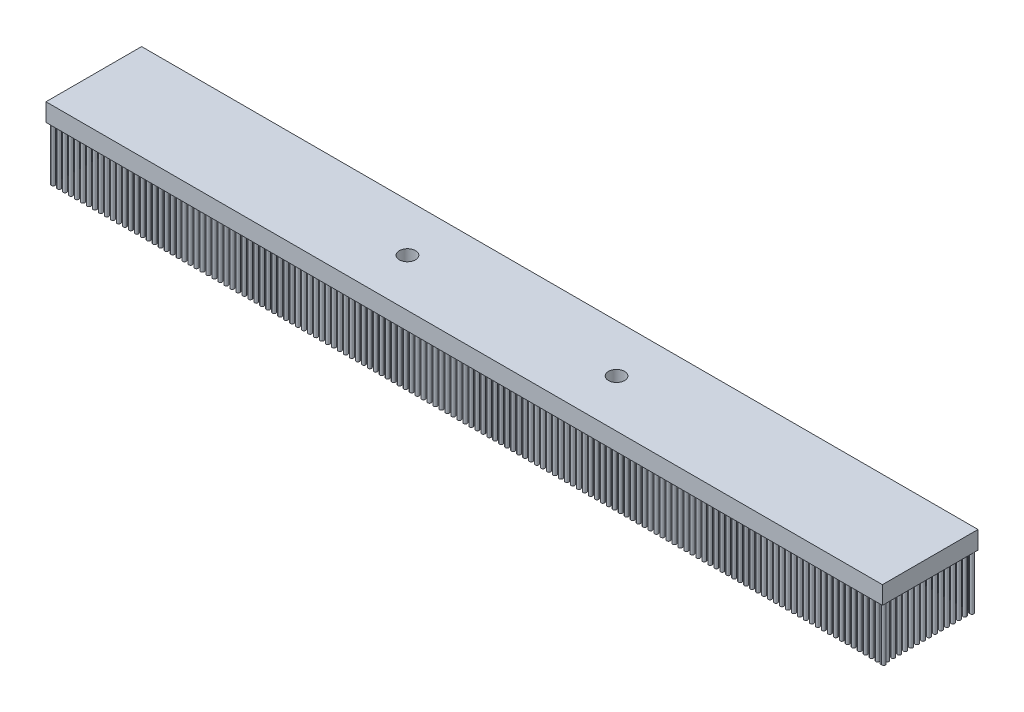
from build123d import *

# Parameters (mm, degrees)
SKETCH1_W               = 700
SKETCH1_H               = 80
BOSS_EXTRUDE1_DEPTH     = 15
SKETCH2_R               = 1.5
BOSS_EXTRUDE2_DEPTH     = 45
CUT_EXTRUDE1_DEPTH      = 356.140817142
CUT_EXTRUDE1_DEPTH_BACK = 356.140817142
SKETCH3_R               = 6.725


with BuildPart() as part:
    # Sketch1 → Boss-Extrude1 (new body)
    with BuildSketch(Plane(origin=(0, 0, 0), x_dir=(1, 0, 0), z_dir=(0, 1, 0))):
        Rectangle(SKETCH1_W, SKETCH1_H)
    extrude(amount=BOSS_EXTRUDE1_DEPTH)

    # Sketch2 → Boss-Extrude2 (add)
    with BuildSketch(Plane(origin=(0, 0, 0), x_dir=(1, 0, 0), z_dir=(0, 1, 0))):
        with Locations((-347, 37)):
            Circle(SKETCH2_R)
        with Locations((-342, 37)):
            Circle(SKETCH2_R)
        with Locations((-337, 37)):
            Circle(SKETCH2_R)
        with Locations((-332, 37)):
            Circle(SKETCH2_R)
        with Locations((-327, 37)):
            Circle(SKETCH2_R)
        with Locations((-322, 37)):
            Circle(SKETCH2_R)
        with Locations((-317, 37)):
            Circle(SKETCH2_R)
        with Locations((-312, 37)):
            Circle(SKETCH2_R)
        with Locations((-307, 37)):
            Circle(SKETCH2_R)
        with Locations((-302, 37)):
            Circle(SKETCH2_R)
        with Locations((-297, 37)):
            Circle(SKETCH2_R)
        with Locations((-292, 37)):
            Circle(SKETCH2_R)
        with Locations((-287, 37)):
            Circle(SKETCH2_R)
        with Locations((-282, 37)):
            Circle(SKETCH2_R)
        with Locations((-277, 37)):
            Circle(SKETCH2_R)
        with Locations((-272, 37)):
            Circle(SKETCH2_R)
        with Locations((-267, 37)):
            Circle(SKETCH2_R)
        with Locations((-262, 37)):
            Circle(SKETCH2_R)
        with Locations((-257, 37)):
            Circle(SKETCH2_R)
        with Locations((-252, 37)):
            Circle(SKETCH2_R)
        with Locations((-247, 37)):
            Circle(SKETCH2_R)
        with Locations((-242, 37)):
            Circle(SKETCH2_R)
        with Locations((-237, 37)):
            Circle(SKETCH2_R)
        with Locations((-232, 37)):
            Circle(SKETCH2_R)
        with Locations((-227, 37)):
            Circle(SKETCH2_R)
        with Locations((-222, 37)):
            Circle(SKETCH2_R)
        with Locations((-217, 37)):
            Circle(SKETCH2_R)
        with Locations((-212, 37)):
            Circle(SKETCH2_R)
        with Locations((-207, 37)):
            Circle(SKETCH2_R)
        with Locations((-202, 37)):
            Circle(SKETCH2_R)
        with Locations((-197, 37)):
            Circle(SKETCH2_R)
        with Locations((-192, 37)):
            Circle(SKETCH2_R)
        with Locations((-187, 37)):
            Circle(SKETCH2_R)
        with Locations((-182, 37)):
            Circle(SKETCH2_R)
        with Locations((-177, 37)):
            Circle(SKETCH2_R)
        with Locations((-172, 37)):
            Circle(SKETCH2_R)
        with Locations((-167, 37)):
            Circle(SKETCH2_R)
        with Locations((-162, 37)):
            Circle(SKETCH2_R)
        with Locations((-157, 37)):
            Circle(SKETCH2_R)
        with Locations((-152, 37)):
            Circle(SKETCH2_R)
        with Locations((-147, 37)):
            Circle(SKETCH2_R)
        with Locations((-142, 37)):
            Circle(SKETCH2_R)
        with Locations((-137, 37)):
            Circle(SKETCH2_R)
        with Locations((-132, 37)):
            Circle(SKETCH2_R)
        with Locations((-127, 37)):
            Circle(SKETCH2_R)
        with Locations((-122, 37)):
            Circle(SKETCH2_R)
        with Locations((-117, 37)):
            Circle(SKETCH2_R)
        with Locations((-112, 37)):
            Circle(SKETCH2_R)
        with Locations((-107, 37)):
            Circle(SKETCH2_R)
        with Locations((-102, 37)):
            Circle(SKETCH2_R)
        with Locations((-97, 37)):
            Circle(SKETCH2_R)
        with Locations((-92, 37)):
            Circle(SKETCH2_R)
        with Locations((-87, 37)):
            Circle(SKETCH2_R)
        with Locations((-82, 37)):
            Circle(SKETCH2_R)
        with Locations((-77, 37)):
            Circle(SKETCH2_R)
        with Locations((-72, 37)):
            Circle(SKETCH2_R)
        with Locations((-67, 37)):
            Circle(SKETCH2_R)
        with Locations((-62, 37)):
            Circle(SKETCH2_R)
        with Locations((-57, 37)):
            Circle(SKETCH2_R)
        with Locations((-52, 37)):
            Circle(SKETCH2_R)
        with Locations((-47, 37)):
            Circle(SKETCH2_R)
        with Locations((-42, 37)):
            Circle(SKETCH2_R)
        with Locations((-37, 37)):
            Circle(SKETCH2_R)
        with Locations((-32, 37)):
            Circle(SKETCH2_R)
        with Locations((-27, 37)):
            Circle(SKETCH2_R)
        with Locations((-22, 37)):
            Circle(SKETCH2_R)
        with Locations((-17, 37)):
            Circle(SKETCH2_R)
        with Locations((-12, 37)):
            Circle(SKETCH2_R)
        with Locations((-7, 37)):
            Circle(SKETCH2_R)
        with Locations((-2, 37)):
            Circle(SKETCH2_R)
        with Locations((3, 37)):
            Circle(SKETCH2_R)
        with Locations((8, 37)):
            Circle(SKETCH2_R)
        with Locations((13, 37)):
            Circle(SKETCH2_R)
        with Locations((18, 37)):
            Circle(SKETCH2_R)
        with Locations((23, 37)):
            Circle(SKETCH2_R)
        with Locations((28, 37)):
            Circle(SKETCH2_R)
        with Locations((33, 37)):
            Circle(SKETCH2_R)
        with Locations((38, 37)):
            Circle(SKETCH2_R)
        with Locations((43, 37)):
            Circle(SKETCH2_R)
        with Locations((48, 37)):
            Circle(SKETCH2_R)
        with Locations((53, 37)):
            Circle(SKETCH2_R)
        with Locations((58, 37)):
            Circle(SKETCH2_R)
        with Locations((63, 37)):
            Circle(SKETCH2_R)
        with Locations((68, 37)):
            Circle(SKETCH2_R)
        with Locations((73, 37)):
            Circle(SKETCH2_R)
        with Locations((78, 37)):
            Circle(SKETCH2_R)
        with Locations((83, 37)):
            Circle(SKETCH2_R)
        with Locations((88, 37)):
            Circle(SKETCH2_R)
        with Locations((93, 37)):
            Circle(SKETCH2_R)
        with Locations((98, 37)):
            Circle(SKETCH2_R)
        with Locations((103, 37)):
            Circle(SKETCH2_R)
        with Locations((108, 37)):
            Circle(SKETCH2_R)
        with Locations((113, 37)):
            Circle(SKETCH2_R)
        with Locations((118, 37)):
            Circle(SKETCH2_R)
        with Locations((123, 37)):
            Circle(SKETCH2_R)
        with Locations((128, 37)):
            Circle(SKETCH2_R)
        with Locations((133, 37)):
            Circle(SKETCH2_R)
        with Locations((138, 37)):
            Circle(SKETCH2_R)
        with Locations((143, 37)):
            Circle(SKETCH2_R)
        with Locations((148, 37)):
            Circle(SKETCH2_R)
        with Locations((153, 37)):
            Circle(SKETCH2_R)
        with Locations((158, 37)):
            Circle(SKETCH2_R)
        with Locations((163, 37)):
            Circle(SKETCH2_R)
        with Locations((168, 37)):
            Circle(SKETCH2_R)
        with Locations((173, 37)):
            Circle(SKETCH2_R)
        with Locations((178, 37)):
            Circle(SKETCH2_R)
        with Locations((183, 37)):
            Circle(SKETCH2_R)
        with Locations((188, 37)):
            Circle(SKETCH2_R)
        with Locations((193, 37)):
            Circle(SKETCH2_R)
        with Locations((198, 37)):
            Circle(SKETCH2_R)
        with Locations((203, 37)):
            Circle(SKETCH2_R)
        with Locations((208, 37)):
            Circle(SKETCH2_R)
        with Locations((213, 37)):
            Circle(SKETCH2_R)
        with Locations((218, 37)):
            Circle(SKETCH2_R)
        with Locations((223, 37)):
            Circle(SKETCH2_R)
        with Locations((228, 37)):
            Circle(SKETCH2_R)
        with Locations((233, 37)):
            Circle(SKETCH2_R)
        with Locations((238, 37)):
            Circle(SKETCH2_R)
        with Locations((243, 37)):
            Circle(SKETCH2_R)
        with Locations((248, 37)):
            Circle(SKETCH2_R)
        with Locations((253, 37)):
            Circle(SKETCH2_R)
        with Locations((258, 37)):
            Circle(SKETCH2_R)
        with Locations((263, 37)):
            Circle(SKETCH2_R)
        with Locations((268, 37)):
            Circle(SKETCH2_R)
        with Locations((273, 37)):
            Circle(SKETCH2_R)
        with Locations((278, 37)):
            Circle(SKETCH2_R)
        with Locations((283, 37)):
            Circle(SKETCH2_R)
        with Locations((288, 37)):
            Circle(SKETCH2_R)
        with Locations((293, 37)):
            Circle(SKETCH2_R)
        with Locations((298, 37)):
            Circle(SKETCH2_R)
        with Locations((303, 37)):
            Circle(SKETCH2_R)
        with Locations((308, 37)):
            Circle(SKETCH2_R)
        with Locations((313, 37)):
            Circle(SKETCH2_R)
        with Locations((318, 37)):
            Circle(SKETCH2_R)
        with Locations((323, 37)):
            Circle(SKETCH2_R)
        with Locations((328, 37)):
            Circle(SKETCH2_R)
        with Locations((333, 37)):
            Circle(SKETCH2_R)
        with Locations((338, 37)):
            Circle(SKETCH2_R)
        with Locations((343, 37)):
            Circle(SKETCH2_R)
        with Locations((348, 37)):
            Circle(SKETCH2_R)
        with Locations((-347, 32)):
            Circle(SKETCH2_R)
        with Locations((-347, 27)):
            Circle(SKETCH2_R)
        with Locations((-347, 22)):
            Circle(SKETCH2_R)
        with Locations((-347, 17)):
            Circle(SKETCH2_R)
        with Locations((-347, 12)):
            Circle(SKETCH2_R)
        with Locations((-347, 7)):
            Circle(SKETCH2_R)
        with Locations((-347, 2)):
            Circle(SKETCH2_R)
        with Locations((-347, -3)):
            Circle(SKETCH2_R)
        with Locations((-347, -8)):
            Circle(SKETCH2_R)
        with Locations((-347, -13)):
            Circle(SKETCH2_R)
        with Locations((-347, -18)):
            Circle(SKETCH2_R)
        with Locations((-347, -23)):
            Circle(SKETCH2_R)
        with Locations((-347, -28)):
            Circle(SKETCH2_R)
        with Locations((-347, -33)):
            Circle(SKETCH2_R)
        with Locations((348, -37)):
            Circle(SKETCH2_R)
        with Locations((343, -37)):
            Circle(SKETCH2_R)
        with Locations((338, -37)):
            Circle(SKETCH2_R)
        with Locations((333, -37)):
            Circle(SKETCH2_R)
        with Locations((328, -37)):
            Circle(SKETCH2_R)
        with Locations((323, -37)):
            Circle(SKETCH2_R)
        with Locations((318, -37)):
            Circle(SKETCH2_R)
        with Locations((313, -37)):
            Circle(SKETCH2_R)
        with Locations((308, -37)):
            Circle(SKETCH2_R)
        with Locations((303, -37)):
            Circle(SKETCH2_R)
        with Locations((298, -37)):
            Circle(SKETCH2_R)
        with Locations((293, -37)):
            Circle(SKETCH2_R)
        with Locations((288, -37)):
            Circle(SKETCH2_R)
        with Locations((283, -37)):
            Circle(SKETCH2_R)
        with Locations((278, -37)):
            Circle(SKETCH2_R)
        with Locations((273, -37)):
            Circle(SKETCH2_R)
        with Locations((268, -37)):
            Circle(SKETCH2_R)
        with Locations((263, -37)):
            Circle(SKETCH2_R)
        with Locations((258, -37)):
            Circle(SKETCH2_R)
        with Locations((253, -37)):
            Circle(SKETCH2_R)
        with Locations((248, -37)):
            Circle(SKETCH2_R)
        with Locations((243, -37)):
            Circle(SKETCH2_R)
        with Locations((238, -37)):
            Circle(SKETCH2_R)
        with Locations((233, -37)):
            Circle(SKETCH2_R)
        with Locations((228, -37)):
            Circle(SKETCH2_R)
        with Locations((223, -37)):
            Circle(SKETCH2_R)
        with Locations((218, -37)):
            Circle(SKETCH2_R)
        with Locations((213, -37)):
            Circle(SKETCH2_R)
        with Locations((208, -37)):
            Circle(SKETCH2_R)
        with Locations((203, -37)):
            Circle(SKETCH2_R)
        with Locations((198, -37)):
            Circle(SKETCH2_R)
        with Locations((193, -37)):
            Circle(SKETCH2_R)
        with Locations((188, -37)):
            Circle(SKETCH2_R)
        with Locations((183, -37)):
            Circle(SKETCH2_R)
        with Locations((178, -37)):
            Circle(SKETCH2_R)
        with Locations((173, -37)):
            Circle(SKETCH2_R)
        with Locations((168, -37)):
            Circle(SKETCH2_R)
        with Locations((163, -37)):
            Circle(SKETCH2_R)
        with Locations((158, -37)):
            Circle(SKETCH2_R)
        with Locations((153, -37)):
            Circle(SKETCH2_R)
        with Locations((148, -37)):
            Circle(SKETCH2_R)
        with Locations((143, -37)):
            Circle(SKETCH2_R)
        with Locations((138, -37)):
            Circle(SKETCH2_R)
        with Locations((133, -37)):
            Circle(SKETCH2_R)
        with Locations((128, -37)):
            Circle(SKETCH2_R)
        with Locations((123, -37)):
            Circle(SKETCH2_R)
        with Locations((118, -37)):
            Circle(SKETCH2_R)
        with Locations((113, -37)):
            Circle(SKETCH2_R)
        with Locations((108, -37)):
            Circle(SKETCH2_R)
        with Locations((103, -37)):
            Circle(SKETCH2_R)
        with Locations((98, -37)):
            Circle(SKETCH2_R)
        with Locations((93, -37)):
            Circle(SKETCH2_R)
        with Locations((88, -37)):
            Circle(SKETCH2_R)
        with Locations((83, -37)):
            Circle(SKETCH2_R)
        with Locations((78, -37)):
            Circle(SKETCH2_R)
        with Locations((73, -37)):
            Circle(SKETCH2_R)
        with Locations((68, -37)):
            Circle(SKETCH2_R)
        with Locations((63, -37)):
            Circle(SKETCH2_R)
        with Locations((58, -37)):
            Circle(SKETCH2_R)
        with Locations((53, -37)):
            Circle(SKETCH2_R)
        with Locations((48, -37)):
            Circle(SKETCH2_R)
        with Locations((43, -37)):
            Circle(SKETCH2_R)
        with Locations((38, -37)):
            Circle(SKETCH2_R)
        with Locations((33, -37)):
            Circle(SKETCH2_R)
        with Locations((28, -37)):
            Circle(SKETCH2_R)
        with Locations((23, -37)):
            Circle(SKETCH2_R)
        with Locations((18, -37)):
            Circle(SKETCH2_R)
        with Locations((13, -37)):
            Circle(SKETCH2_R)
        with Locations((8, -37)):
            Circle(SKETCH2_R)
        with Locations((3, -37)):
            Circle(SKETCH2_R)
        with Locations((-2, -37)):
            Circle(SKETCH2_R)
        with Locations((-7, -37)):
            Circle(SKETCH2_R)
        with Locations((-12, -37)):
            Circle(SKETCH2_R)
        with Locations((-17, -37)):
            Circle(SKETCH2_R)
        with Locations((-22, -37)):
            Circle(SKETCH2_R)
        with Locations((-27, -37)):
            Circle(SKETCH2_R)
        with Locations((-32, -37)):
            Circle(SKETCH2_R)
        with Locations((-37, -37)):
            Circle(SKETCH2_R)
        with Locations((-42, -37)):
            Circle(SKETCH2_R)
        with Locations((-47, -37)):
            Circle(SKETCH2_R)
        with Locations((-52, -37)):
            Circle(SKETCH2_R)
        with Locations((-57, -37)):
            Circle(SKETCH2_R)
        with Locations((-62, -37)):
            Circle(SKETCH2_R)
        with Locations((-67, -37)):
            Circle(SKETCH2_R)
        with Locations((-72, -37)):
            Circle(SKETCH2_R)
        with Locations((-77, -37)):
            Circle(SKETCH2_R)
        with Locations((-82, -37)):
            Circle(SKETCH2_R)
        with Locations((-87, -37)):
            Circle(SKETCH2_R)
        with Locations((-92, -37)):
            Circle(SKETCH2_R)
        with Locations((-97, -37)):
            Circle(SKETCH2_R)
        with Locations((-102, -37)):
            Circle(SKETCH2_R)
        with Locations((-107, -37)):
            Circle(SKETCH2_R)
        with Locations((-112, -37)):
            Circle(SKETCH2_R)
        with Locations((-117, -37)):
            Circle(SKETCH2_R)
        with Locations((-122, -37)):
            Circle(SKETCH2_R)
        with Locations((-127, -37)):
            Circle(SKETCH2_R)
        with Locations((-132, -37)):
            Circle(SKETCH2_R)
        with Locations((-137, -37)):
            Circle(SKETCH2_R)
        with Locations((-142, -37)):
            Circle(SKETCH2_R)
        with Locations((-147, -37)):
            Circle(SKETCH2_R)
        with Locations((-152, -37)):
            Circle(SKETCH2_R)
        with Locations((-157, -37)):
            Circle(SKETCH2_R)
        with Locations((-162, -37)):
            Circle(SKETCH2_R)
        with Locations((-167, -37)):
            Circle(SKETCH2_R)
        with Locations((-172, -37)):
            Circle(SKETCH2_R)
        with Locations((-177, -37)):
            Circle(SKETCH2_R)
        with Locations((-182, -37)):
            Circle(SKETCH2_R)
        with Locations((-187, -37)):
            Circle(SKETCH2_R)
        with Locations((-192, -37)):
            Circle(SKETCH2_R)
        with Locations((-197, -37)):
            Circle(SKETCH2_R)
        with Locations((-202, -37)):
            Circle(SKETCH2_R)
        with Locations((-207, -37)):
            Circle(SKETCH2_R)
        with Locations((-212, -37)):
            Circle(SKETCH2_R)
        with Locations((-217, -37)):
            Circle(SKETCH2_R)
        with Locations((-222, -37)):
            Circle(SKETCH2_R)
        with Locations((-227, -37)):
            Circle(SKETCH2_R)
        with Locations((-232, -37)):
            Circle(SKETCH2_R)
        with Locations((-237, -37)):
            Circle(SKETCH2_R)
        with Locations((-242, -37)):
            Circle(SKETCH2_R)
        with Locations((-247, -37)):
            Circle(SKETCH2_R)
        with Locations((-252, -37)):
            Circle(SKETCH2_R)
        with Locations((-257, -37)):
            Circle(SKETCH2_R)
        with Locations((-262, -37)):
            Circle(SKETCH2_R)
        with Locations((-267, -37)):
            Circle(SKETCH2_R)
        with Locations((-272, -37)):
            Circle(SKETCH2_R)
        with Locations((-277, -37)):
            Circle(SKETCH2_R)
        with Locations((-282, -37)):
            Circle(SKETCH2_R)
        with Locations((-287, -37)):
            Circle(SKETCH2_R)
        with Locations((-292, -37)):
            Circle(SKETCH2_R)
        with Locations((-297, -37)):
            Circle(SKETCH2_R)
        with Locations((-302, -37)):
            Circle(SKETCH2_R)
        with Locations((-307, -37)):
            Circle(SKETCH2_R)
        with Locations((-312, -37)):
            Circle(SKETCH2_R)
        with Locations((-317, -37)):
            Circle(SKETCH2_R)
        with Locations((-322, -37)):
            Circle(SKETCH2_R)
        with Locations((-327, -37)):
            Circle(SKETCH2_R)
        with Locations((-332, -37)):
            Circle(SKETCH2_R)
        with Locations((-337, -37)):
            Circle(SKETCH2_R)
        with Locations((-342, -37)):
            Circle(SKETCH2_R)
        with Locations((-347, -37)):
            Circle(SKETCH2_R)
        with Locations((347, -37)):
            Circle(SKETCH2_R)
        with Locations((347, -33)):
            Circle(SKETCH2_R)
        with Locations((347, -28)):
            Circle(SKETCH2_R)
        with Locations((347, -23)):
            Circle(SKETCH2_R)
        with Locations((347, -18)):
            Circle(SKETCH2_R)
        with Locations((347, -13)):
            Circle(SKETCH2_R)
        with Locations((347, -8)):
            Circle(SKETCH2_R)
        with Locations((347, -3)):
            Circle(SKETCH2_R)
        with Locations((347, 2)):
            Circle(SKETCH2_R)
        with Locations((347, 7)):
            Circle(SKETCH2_R)
        with Locations((347, 12)):
            Circle(SKETCH2_R)
        with Locations((347, 17)):
            Circle(SKETCH2_R)
        with Locations((347, 22)):
            Circle(SKETCH2_R)
        with Locations((347, 27)):
            Circle(SKETCH2_R)
        with Locations((347, 32)):
            Circle(SKETCH2_R)
        with Locations((347, 37)):
            Circle(SKETCH2_R)
    extrude(amount=-BOSS_EXTRUDE2_DEPTH)

    # Sketch3 → Cut-Extrude1 (cut, two sides: drawn at the far end of the back side and taken through both)
    with BuildSketch(Plane(origin=(0, 0, 0), x_dir=(1, 0, 0), z_dir=(0, 1, 0)).offset(-CUT_EXTRUDE1_DEPTH_BACK)):
        with Locations((-87.5, 0)):
            Circle(SKETCH3_R)
        with Locations((87.5, 0)):
            Circle(SKETCH3_R)
    extrude(amount=CUT_EXTRUDE1_DEPTH + CUT_EXTRUDE1_DEPTH_BACK, mode=Mode.SUBTRACT)


solid = part.part
